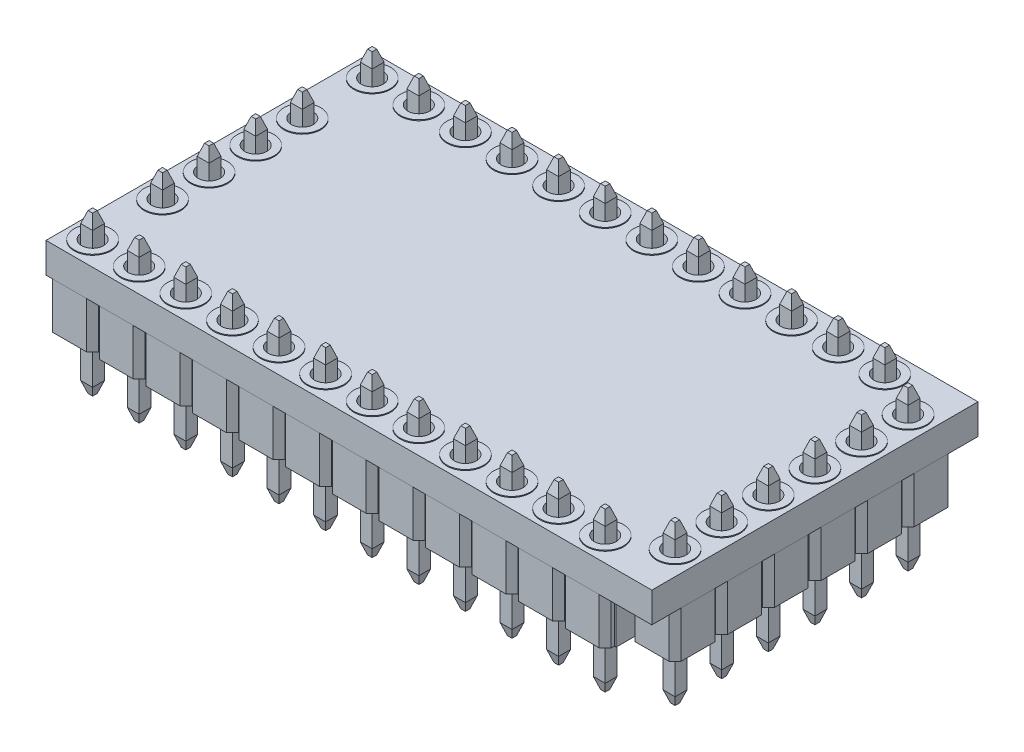
from build123d import *
from OCP.BRepFilletAPI import BRepFilletAPI_MakeChamfer

# Parameters (mm, degrees)
SKETCH1_W                   = 33.02
SKETCH1_H                   = 17.78
BOSS_EXTRUDE1_DEPTH         = 1.64
SKETCH2_R                   = 0.6
CUT_EXTRUDE1_DEPTH          = 19.822906258
SKETCH3_R                   = 1
SKETCH3_R_2                 = 0.6
BOSS_EXTRUDE2_DEPTH         = 0.05
BOSS_EXTRUDE4_DEPTH         = 2.54
BOSS_EXTRUDE5_START         = -3.05
SKETCH6_W                   = 0.65
SKETCH6_H                   = 0.65
BOSS_EXTRUDE5_DEPTH         = 8.64
CHAMFER1_SIZE               = 0.2
CHAMFER1_SIZE2              = 0.615536707
LPATTERN2_COUNT             = 12
LPATTERN2_PITCH             = 2.54
CHAMFER1_OF_LPATTERN2_SIZE  = 0.2
CHAMFER1_OF_LPATTERN2_SIZE2 = 0.615536707
BOSS_EXTRUDE6_DEPTH         = 2.54
BOSS_EXTRUDE7_START         = -5.07
SKETCH8_W                   = 0.65
SKETCH8_H                   = 0.65
BOSS_EXTRUDE7_DEPTH         = 8.12
CHAMFER2_SIZE               = 0.2
CHAMFER2_SIZE2              = 0.615536707
LPATTERN7_COUNT             = 4
LPATTERN7_PITCH             = 2.54
CHAMFER2_OF_LPATTERN7_SIZE  = 0.2
CHAMFER2_OF_LPATTERN7_SIZE2 = 0.615536707
BOSS_EXTRUDE8_DEPTH         = 2.54
BOSS_EXTRUDE9_START         = -5.59
SKETCH10_W                  = 0.65
SKETCH10_H                  = 0.65
BOSS_EXTRUDE9_DEPTH         = 8.64
CHAMFER3_SIZE               = 0.2
CHAMFER3_SIZE2              = 0.615536707
LPATTERN8_COUNT             = 6
LPATTERN8_PITCH             = 2.54
CHAMFER3_OF_LPATTERN8_SIZE  = 0.2
CHAMFER3_OF_LPATTERN8_SIZE2 = 0.615536707


with BuildPart() as part:
    # Sketch1 → Boss-Extrude1 (new body)
    with BuildSketch(Plane(origin=(0, 2.54, 0), x_dir=(1, 0, 0), z_dir=(0, 1, 0))):
        Rectangle(SKETCH1_W, SKETCH1_H)
    extrude(amount=BOSS_EXTRUDE1_DEPTH)

    # Sketch2 → Cut-Extrude1 (cut, through all)
    with BuildSketch(Plane.XZ.offset(-2.54)):
        with Locations(Location((-15.24, 7.62, 0), (0, 0, 270))):
            Circle(SKETCH2_R)
        with Locations(Location((-12.7, 7.62, 0), (0, 0, 270))):
            Circle(SKETCH2_R)
        with Locations(Location((-10.16, 7.62, 0), (0, 0, 270))):
            Circle(SKETCH2_R)
        with Locations(Location((-7.62, 7.62, 0), (0, 0, 270))):
            Circle(SKETCH2_R)
        with Locations(Location((-5.08, 7.62, 0), (0, 0, 270))):
            Circle(SKETCH2_R)
        with Locations(Location((-2.54, 7.62, 0), (0, 0, 270))):
            Circle(SKETCH2_R)
        with Locations(Location((0, 7.62, 0), (0, 0, 270))):
            Circle(SKETCH2_R)
        with Locations(Location((2.54, 7.62, 0), (0, 0, 270))):
            Circle(SKETCH2_R)
        with Locations(Location((5.08, 7.62, 0), (0, 0, 270))):
            Circle(SKETCH2_R)
        with Locations(Location((7.62, 7.62, 0), (0, 0, 270))):
            Circle(SKETCH2_R)
        with Locations(Location((10.16, 7.62, 0), (0, 0, 270))):
            Circle(SKETCH2_R)
        with Locations(Location((12.7, 7.62, 0), (0, 0, 270))):
            Circle(SKETCH2_R)
        with Locations(Location((12.7, -7.62, 0), (0, 0, 90))):
            Circle(SKETCH2_R)
        with Locations(Location((10.16, -7.62, 0), (0, 0, 90))):
            Circle(SKETCH2_R)
        with Locations(Location((7.62, -7.62, 0), (0, 0, 90))):
            Circle(SKETCH2_R)
        with Locations(Location((5.08, -7.62, 0), (0, 0, 90))):
            Circle(SKETCH2_R)
        with Locations(Location((2.54, -7.62, 0), (0, 0, 90))):
            Circle(SKETCH2_R)
        with Locations(Location((0, -7.62, 0), (0, 0, 90))):
            Circle(SKETCH2_R)
        with Locations(Location((-2.54, -7.62, 0), (0, 0, 90))):
            Circle(SKETCH2_R)
        with Locations(Location((-5.08, -7.62, 0), (0, 0, 90))):
            Circle(SKETCH2_R)
        with Locations(Location((-7.62, -7.62, 0), (0, 0, 90))):
            Circle(SKETCH2_R)
        with Locations(Location((-10.16, -7.62, 0), (0, 0, 90))):
            Circle(SKETCH2_R)
        with Locations(Location((-12.7, -7.62, 0), (0, 0, 90))):
            Circle(SKETCH2_R)
        with Locations(Location((-15.24, -7.62, 0), (0, 0, 90))):
            Circle(SKETCH2_R)
        with Locations(Location((-15.24, 3.81, 0), (0, 0, 270))):
            Circle(SKETCH2_R)
        with Locations(Location((15.24, 6.35, 0), (0, 0, 270))):
            Circle(SKETCH2_R)
        with Locations(Location((-15.24, 1.27, 0), (0, 0, 270))):
            Circle(SKETCH2_R)
        with Locations(Location((-15.24, -1.27, 0), (0, 0, 270))):
            Circle(SKETCH2_R)
        with Locations(Location((-15.24, -3.81, 0), (0, 0, 270))):
            Circle(SKETCH2_R)
        with Locations(Location((15.24, 3.81, 0), (0, 0, 270))):
            Circle(SKETCH2_R)
        with Locations(Location((15.24, 1.27, 0), (0, 0, 270))):
            Circle(SKETCH2_R)
        with Locations(Location((15.24, -1.27, 0), (0, 0, 270))):
            Circle(SKETCH2_R)
        with Locations(Location((15.24, -3.81, 0), (0, 0, 270))):
            Circle(SKETCH2_R)
        with Locations(Location((15.24, -6.35, 0), (0, 0, 270))):
            Circle(SKETCH2_R)
    extrude(amount=-CUT_EXTRUDE1_DEPTH, mode=Mode.SUBTRACT)

    # Sketch3 → Boss-Extrude2 (add)
    # profile 1 of 34: a face of its own
    with BuildSketch(Plane(origin=(0, 4.18, 0), x_dir=(1, 0, 0), z_dir=(0, 1, 0))):
        with Locations(Location((-15.24, 7.62, 0), (0, 0, 270))):
            Circle(SKETCH3_R)
        with Locations(Location((-15.24, 7.62, 0), (0, 0, 270))):
            Circle(SKETCH3_R_2, mode=Mode.SUBTRACT)
    # profile 2 of 34: a face of its own
    with BuildSketch(Plane(origin=(0, 4.18, 0), x_dir=(1, 0, 0), z_dir=(0, 1, 0))):
        with Locations(Location((-12.7, 7.62, 0), (0, 0, 270))):
            Circle(SKETCH3_R)
        with Locations(Location((-12.7, 7.62, 0), (0, 0, 270))):
            Circle(SKETCH3_R_2, mode=Mode.SUBTRACT)
    # profile 3 of 34: a face of its own
    with BuildSketch(Plane(origin=(0, 4.18, 0), x_dir=(1, 0, 0), z_dir=(0, 1, 0))):
        with Locations(Location((-10.16, 7.62, 0), (0, 0, 270))):
            Circle(SKETCH3_R)
        with Locations(Location((-10.16, 7.62, 0), (0, 0, 270))):
            Circle(SKETCH3_R_2, mode=Mode.SUBTRACT)
    # profile 4 of 34: a face of its own
    with BuildSketch(Plane(origin=(0, 4.18, 0), x_dir=(1, 0, 0), z_dir=(0, 1, 0))):
        with Locations(Location((-7.62, 7.62, 0), (0, 0, 270))):
            Circle(SKETCH3_R)
        with Locations(Location((-7.62, 7.62, 0), (0, 0, 270))):
            Circle(SKETCH3_R_2, mode=Mode.SUBTRACT)
    # profile 5 of 34: a face of its own
    with BuildSketch(Plane(origin=(0, 4.18, 0), x_dir=(1, 0, 0), z_dir=(0, 1, 0))):
        with Locations(Location((-5.08, 7.62, 0), (0, 0, 270))):
            Circle(SKETCH3_R)
        with Locations(Location((-5.08, 7.62, 0), (0, 0, 270))):
            Circle(SKETCH3_R_2, mode=Mode.SUBTRACT)
    # profile 6 of 34: a face of its own
    with BuildSketch(Plane(origin=(0, 4.18, 0), x_dir=(1, 0, 0), z_dir=(0, 1, 0))):
        with Locations(Location((-2.54, 7.62, 0), (0, 0, 270))):
            Circle(SKETCH3_R)
        with Locations(Location((-2.54, 7.62, 0), (0, 0, 270))):
            Circle(SKETCH3_R_2, mode=Mode.SUBTRACT)
    # profile 7 of 34: a face of its own
    with BuildSketch(Plane(origin=(0, 4.18, 0), x_dir=(1, 0, 0), z_dir=(0, 1, 0))):
        with Locations(Location((0, 7.62, 0), (0, 0, 270))):
            Circle(SKETCH3_R)
        with Locations(Location((0, 7.62, 0), (0, 0, 270))):
            Circle(SKETCH3_R_2, mode=Mode.SUBTRACT)
    # profile 8 of 34: a face of its own
    with BuildSketch(Plane(origin=(0, 4.18, 0), x_dir=(1, 0, 0), z_dir=(0, 1, 0))):
        with Locations(Location((2.54, 7.62, 0), (0, 0, 270))):
            Circle(SKETCH3_R)
        with Locations(Location((2.54, 7.62, 0), (0, 0, 270))):
            Circle(SKETCH3_R_2, mode=Mode.SUBTRACT)
    # profile 9 of 34: a face of its own
    with BuildSketch(Plane(origin=(0, 4.18, 0), x_dir=(1, 0, 0), z_dir=(0, 1, 0))):
        with Locations(Location((5.08, 7.62, 0), (0, 0, 270))):
            Circle(SKETCH3_R)
        with Locations(Location((5.08, 7.62, 0), (0, 0, 270))):
            Circle(SKETCH3_R_2, mode=Mode.SUBTRACT)
    # profile 10 of 34: a face of its own
    with BuildSketch(Plane(origin=(0, 4.18, 0), x_dir=(1, 0, 0), z_dir=(0, 1, 0))):
        with Locations(Location((7.62, 7.62, 0), (0, 0, 270))):
            Circle(SKETCH3_R)
        with Locations(Location((7.62, 7.62, 0), (0, 0, 270))):
            Circle(SKETCH3_R_2, mode=Mode.SUBTRACT)
    # profile 11 of 34: a face of its own
    with BuildSketch(Plane(origin=(0, 4.18, 0), x_dir=(1, 0, 0), z_dir=(0, 1, 0))):
        with Locations(Location((10.16, 7.62, 0), (0, 0, 270))):
            Circle(SKETCH3_R)
        with Locations(Location((10.16, 7.62, 0), (0, 0, 270))):
            Circle(SKETCH3_R_2, mode=Mode.SUBTRACT)
    # profile 12 of 34: a face of its own
    with BuildSketch(Plane(origin=(0, 4.18, 0), x_dir=(1, 0, 0), z_dir=(0, 1, 0))):
        with Locations(Location((12.7, 7.62, 0), (0, 0, 270))):
            Circle(SKETCH3_R)
        with Locations(Location((12.7, 7.62, 0), (0, 0, 270))):
            Circle(SKETCH3_R_2, mode=Mode.SUBTRACT)
    # profile 13 of 34: a face of its own
    with BuildSketch(Plane(origin=(0, 4.18, 0), x_dir=(1, 0, 0), z_dir=(0, 1, 0))):
        with Locations(Location((15.24, 6.35, 0), (0, 0, 270))):
            Circle(SKETCH3_R)
        with Locations(Location((15.24, 6.35, 0), (0, 0, 90))):
            Circle(SKETCH3_R_2, mode=Mode.SUBTRACT)
    # profile 14 of 34: a face of its own
    with BuildSketch(Plane(origin=(0, 4.18, 0), x_dir=(1, 0, 0), z_dir=(0, 1, 0))):
        with Locations(Location((15.24, 3.81, 0), (0, 0, 270))):
            Circle(SKETCH3_R)
        with Locations(Location((15.24, 3.81, 0), (0, 0, 90))):
            Circle(SKETCH3_R_2, mode=Mode.SUBTRACT)
    # profile 15 of 34: a face of its own
    with BuildSketch(Plane(origin=(0, 4.18, 0), x_dir=(1, 0, 0), z_dir=(0, 1, 0))):
        with Locations(Location((15.24, 1.27, 0), (0, 0, 270))):
            Circle(SKETCH3_R)
        with Locations(Location((15.24, 1.27, 0), (0, 0, 90))):
            Circle(SKETCH3_R_2, mode=Mode.SUBTRACT)
    # profile 16 of 34: a face of its own
    with BuildSketch(Plane(origin=(0, 4.18, 0), x_dir=(1, 0, 0), z_dir=(0, 1, 0))):
        with Locations(Location((15.24, -1.27, 0), (0, 0, 270))):
            Circle(SKETCH3_R)
        with Locations(Location((15.24, -1.27, 0), (0, 0, 90))):
            Circle(SKETCH3_R_2, mode=Mode.SUBTRACT)
    # profile 17 of 34: a face of its own
    with BuildSketch(Plane(origin=(0, 4.18, 0), x_dir=(1, 0, 0), z_dir=(0, 1, 0))):
        with Locations(Location((15.24, -3.81, 0), (0, 0, 270))):
            Circle(SKETCH3_R)
        with Locations(Location((15.24, -3.81, 0), (0, 0, 90))):
            Circle(SKETCH3_R_2, mode=Mode.SUBTRACT)
    # profile 18 of 34: a face of its own
    with BuildSketch(Plane(origin=(0, 4.18, 0), x_dir=(1, 0, 0), z_dir=(0, 1, 0))):
        with Locations(Location((15.24, -6.35, 0), (0, 0, 270))):
            Circle(SKETCH3_R)
        with Locations(Location((15.24, -6.35, 0), (0, 0, 90))):
            Circle(SKETCH3_R_2, mode=Mode.SUBTRACT)
    # profile 19 of 34: a face of its own
    with BuildSketch(Plane(origin=(0, 4.18, 0), x_dir=(1, 0, 0), z_dir=(0, 1, 0))):
        with Locations(Location((12.7, -7.62, 0), (0, 0, 270))):
            Circle(SKETCH3_R)
        with Locations(Location((12.7, -7.62, 0), (0, 0, 90))):
            Circle(SKETCH3_R_2, mode=Mode.SUBTRACT)
    # profile 20 of 34: a face of its own
    with BuildSketch(Plane(origin=(0, 4.18, 0), x_dir=(1, 0, 0), z_dir=(0, 1, 0))):
        with Locations(Location((10.16, -7.62, 0), (0, 0, 270))):
            Circle(SKETCH3_R)
        with Locations(Location((10.16, -7.62, 0), (0, 0, 90))):
            Circle(SKETCH3_R_2, mode=Mode.SUBTRACT)
    # profile 21 of 34: a face of its own
    with BuildSketch(Plane(origin=(0, 4.18, 0), x_dir=(1, 0, 0), z_dir=(0, 1, 0))):
        with Locations(Location((7.62, -7.62, 0), (0, 0, 270))):
            Circle(SKETCH3_R)
        with Locations(Location((7.62, -7.62, 0), (0, 0, 90))):
            Circle(SKETCH3_R_2, mode=Mode.SUBTRACT)
    # profile 22 of 34: a face of its own
    with BuildSketch(Plane(origin=(0, 4.18, 0), x_dir=(1, 0, 0), z_dir=(0, 1, 0))):
        with Locations(Location((5.08, -7.62, 0), (0, 0, 270))):
            Circle(SKETCH3_R)
        with Locations(Location((5.08, -7.62, 0), (0, 0, 90))):
            Circle(SKETCH3_R_2, mode=Mode.SUBTRACT)
    # profile 23 of 34: a face of its own
    with BuildSketch(Plane(origin=(0, 4.18, 0), x_dir=(1, 0, 0), z_dir=(0, 1, 0))):
        with Locations(Location((2.54, -7.62, 0), (0, 0, 270))):
            Circle(SKETCH3_R)
        with Locations(Location((2.54, -7.62, 0), (0, 0, 90))):
            Circle(SKETCH3_R_2, mode=Mode.SUBTRACT)
    # profile 24 of 34: a face of its own
    with BuildSketch(Plane(origin=(0, 4.18, 0), x_dir=(1, 0, 0), z_dir=(0, 1, 0))):
        with Locations(Location((0, -7.62, 0), (0, 0, 270))):
            Circle(SKETCH3_R)
        with Locations(Location((0, -7.62, 0), (0, 0, 90))):
            Circle(SKETCH3_R_2, mode=Mode.SUBTRACT)
    # profile 25 of 34: a face of its own
    with BuildSketch(Plane(origin=(0, 4.18, 0), x_dir=(1, 0, 0), z_dir=(0, 1, 0))):
        with Locations(Location((-2.54, -7.62, 0), (0, 0, 270))):
            Circle(SKETCH3_R)
        with Locations(Location((-2.54, -7.62, 0), (0, 0, 90))):
            Circle(SKETCH3_R_2, mode=Mode.SUBTRACT)
    # profile 26 of 34: a face of its own
    with BuildSketch(Plane(origin=(0, 4.18, 0), x_dir=(1, 0, 0), z_dir=(0, 1, 0))):
        with Locations(Location((-5.08, -7.62, 0), (0, 0, 270))):
            Circle(SKETCH3_R)
        with Locations(Location((-5.08, -7.62, 0), (0, 0, 90))):
            Circle(SKETCH3_R_2, mode=Mode.SUBTRACT)
    # profile 27 of 34: a face of its own
    with BuildSketch(Plane(origin=(0, 4.18, 0), x_dir=(1, 0, 0), z_dir=(0, 1, 0))):
        with Locations(Location((-7.62, -7.62, 0), (0, 0, 270))):
            Circle(SKETCH3_R)
        with Locations(Location((-7.62, -7.62, 0), (0, 0, 90))):
            Circle(SKETCH3_R_2, mode=Mode.SUBTRACT)
    # profile 28 of 34: a face of its own
    with BuildSketch(Plane(origin=(0, 4.18, 0), x_dir=(1, 0, 0), z_dir=(0, 1, 0))):
        with Locations(Location((-10.16, -7.62, 0), (0, 0, 270))):
            Circle(SKETCH3_R)
        with Locations(Location((-10.16, -7.62, 0), (0, 0, 90))):
            Circle(SKETCH3_R_2, mode=Mode.SUBTRACT)
    # profile 29 of 34: a face of its own
    with BuildSketch(Plane(origin=(0, 4.18, 0), x_dir=(1, 0, 0), z_dir=(0, 1, 0))):
        with Locations(Location((-12.7, -7.62, 0), (0, 0, 270))):
            Circle(SKETCH3_R)
        with Locations(Location((-12.7, -7.62, 0), (0, 0, 90))):
            Circle(SKETCH3_R_2, mode=Mode.SUBTRACT)
    # profile 30 of 34: a face of its own
    with BuildSketch(Plane(origin=(0, 4.18, 0), x_dir=(1, 0, 0), z_dir=(0, 1, 0))):
        with Locations(Location((-15.24, -7.62, 0), (0, 0, 270))):
            Circle(SKETCH3_R)
        with Locations(Location((-15.24, -7.62, 0), (0, 0, 90))):
            Circle(SKETCH3_R_2, mode=Mode.SUBTRACT)
    # profile 31 of 34: a face of its own
    with BuildSketch(Plane(origin=(0, 4.18, 0), x_dir=(1, 0, 0), z_dir=(0, 1, 0))):
        with Locations(Location((-15.24, -3.81, 0), (0, 0, 270))):
            Circle(SKETCH3_R)
        with Locations(Location((-15.24, -3.81, 0), (0, 0, 90))):
            Circle(SKETCH3_R_2, mode=Mode.SUBTRACT)
    # profile 32 of 34: a face of its own
    with BuildSketch(Plane(origin=(0, 4.18, 0), x_dir=(1, 0, 0), z_dir=(0, 1, 0))):
        with Locations(Location((-15.24, -1.27, 0), (0, 0, 270))):
            Circle(SKETCH3_R)
        with Locations(Location((-15.24, -1.27, 0), (0, 0, 90))):
            Circle(SKETCH3_R_2, mode=Mode.SUBTRACT)
    # profile 33 of 34: a face of its own
    with BuildSketch(Plane(origin=(0, 4.18, 0), x_dir=(1, 0, 0), z_dir=(0, 1, 0))):
        with Locations(Location((-15.24, 1.27, 0), (0, 0, 270))):
            Circle(SKETCH3_R)
        with Locations(Location((-15.24, 1.27, 0), (0, 0, 90))):
            Circle(SKETCH3_R_2, mode=Mode.SUBTRACT)
    # profile 34 of 34: a face of its own
    with BuildSketch(Plane(origin=(0, 4.18, 0), x_dir=(1, 0, 0), z_dir=(0, 1, 0))):
        with Locations(Location((-15.24, 3.81, 0), (0, 0, 270))):
            Circle(SKETCH3_R)
        with Locations(Location((-15.24, 3.81, 0), (0, 0, 90))):
            Circle(SKETCH3_R_2, mode=Mode.SUBTRACT)
    extrude(amount=BOSS_EXTRUDE2_DEPTH)

    # Sketch5 → Boss-Extrude4 (add)
    with BuildSketch(Plane.XZ):
        Polygon((-16.165, 8.87), (-16.49, 8.545), (-16.49, 6.695), (-16.165, 6.37), (-14.315, 6.37), (-13.99, 6.695), (-13.99, 6.87), (-13.89, 6.87), (-13.89, 8.37), (-13.99, 8.37), (-13.99, 8.545), (-14.315, 8.87), align=None)
    boss_extrude4 = extrude(amount=-BOSS_EXTRUDE4_DEPTH)

    # Sketch6 → Boss-Extrude5 (add)
    with BuildSketch(Plane(origin=(0, 2.54, 0), x_dir=(-1, 0, 0), z_dir=(0, -1, 0)).offset(BOSS_EXTRUDE5_START)):
        with Locations((15.24, -7.62)):
            Rectangle(SKETCH6_W, SKETCH6_H)
    boss_extrude5 = extrude(amount=BOSS_EXTRUDE5_DEPTH)

    # Chamfer1: one chamfer whose edges measure the first distance from different faces: ONE call of the kernel's chamfer builder (chamfer() names one face for all edges)
    chamfer1_edges_1 = [part.edges().sort_by_distance(p)[0] for p in [
        (-15.565, 5.59, 7.62),
        (-15.24, 5.59, 7.945),
        (-14.915, 5.59, 7.62),
        (-15.24, 5.59, 7.295),
    ]]
    chamfer1_side_1 = [part.faces().sort_by_distance(p)[0] for p in [
        (-15.24, 5.59, 7.62),
    ]]
    chamfer1_edges_2 = [part.edges().sort_by_distance(p)[0] for p in [
        (-15.565, -3.05, 7.62),
        (-15.24, -3.05, 7.295),
        (-14.915, -3.05, 7.62),
        (-15.24, -3.05, 7.945),
    ]]
    chamfer1_side_2 = [part.faces().sort_by_distance(p)[0] for p in [
        (-15.24, -3.05, 7.62),
    ]]
    chamfer1 = BRepFilletAPI_MakeChamfer(part.part.solid().wrapped)
    for e in chamfer1_edges_1:
        chamfer1.Add(CHAMFER1_SIZE, CHAMFER1_SIZE2, e.wrapped, chamfer1_side_1[0].wrapped)  # the first distance lies on this face
    for e in chamfer1_edges_2:
        chamfer1.Add(CHAMFER1_SIZE, CHAMFER1_SIZE2, e.wrapped, chamfer1_side_2[0].wrapped)  # the first distance lies on this face
    add(Compound.cast(chamfer1.Shape()), mode=Mode.REPLACE)

    # LPattern2: Boss-Extrude4, Boss-Extrude5 ×12
    with Locations(*[(i * LPATTERN2_PITCH, 0, 0) for i in range(1, LPATTERN2_COUNT)]):
        add(boss_extrude4)
        add(boss_extrude5)

    # Chamfer1 of LPattern2: one chamfer whose edges measure the first distance from different faces: ONE call of the kernel's chamfer builder (chamfer() names one face for all edges)
    chamfer1_of_lpattern2_edges_1 = [part.edges().sort_by_distance(p)[0] for p in [
        (-13.025, 5.59, 7.62),
        (-12.7, 5.59, 7.945),
        (-12.375, 5.59, 7.62),
        (-12.7, 5.59, 7.295),
    ]]
    chamfer1_of_lpattern2_side_1 = [part.faces().sort_by_distance(p)[0] for p in [
        (-12.7, 5.59, 7.62),
    ]]
    chamfer1_of_lpattern2_edges_2 = [part.edges().sort_by_distance(p)[0] for p in [
        (-13.025, -3.05, 7.62),
        (-12.7, -3.05, 7.295),
        (-12.375, -3.05, 7.62),
        (-12.7, -3.05, 7.945),
    ]]
    chamfer1_of_lpattern2_side_2 = [part.faces().sort_by_distance(p)[0] for p in [
        (-12.7, -3.05, 7.62),
    ]]
    chamfer1_of_lpattern2_edges_3 = [part.edges().sort_by_distance(p)[0] for p in [
        (-10.485, 5.59, 7.62),
        (-10.16, 5.59, 7.945),
        (-9.835, 5.59, 7.62),
        (-10.16, 5.59, 7.295),
    ]]
    chamfer1_of_lpattern2_side_3 = [part.faces().sort_by_distance(p)[0] for p in [
        (-10.16, 5.59, 7.62),
    ]]
    chamfer1_of_lpattern2_edges_4 = [part.edges().sort_by_distance(p)[0] for p in [
        (-10.485, -3.05, 7.62),
        (-10.16, -3.05, 7.295),
        (-9.835, -3.05, 7.62),
        (-10.16, -3.05, 7.945),
    ]]
    chamfer1_of_lpattern2_side_4 = [part.faces().sort_by_distance(p)[0] for p in [
        (-10.16, -3.05, 7.62),
    ]]
    chamfer1_of_lpattern2_edges_5 = [part.edges().sort_by_distance(p)[0] for p in [
        (-7.945, 5.59, 7.62),
        (-7.62, 5.59, 7.945),
        (-7.295, 5.59, 7.62),
        (-7.62, 5.59, 7.295),
    ]]
    chamfer1_of_lpattern2_side_5 = [part.faces().sort_by_distance(p)[0] for p in [
        (-7.62, 5.59, 7.62),
    ]]
    chamfer1_of_lpattern2_edges_6 = [part.edges().sort_by_distance(p)[0] for p in [
        (-7.945, -3.05, 7.62),
        (-7.62, -3.05, 7.295),
        (-7.295, -3.05, 7.62),
        (-7.62, -3.05, 7.945),
    ]]
    chamfer1_of_lpattern2_side_6 = [part.faces().sort_by_distance(p)[0] for p in [
        (-7.62, -3.05, 7.62),
    ]]
    chamfer1_of_lpattern2_edges_7 = [part.edges().sort_by_distance(p)[0] for p in [
        (-5.405, 5.59, 7.62),
        (-5.08, 5.59, 7.945),
        (-4.755, 5.59, 7.62),
        (-5.08, 5.59, 7.295),
    ]]
    chamfer1_of_lpattern2_side_7 = [part.faces().sort_by_distance(p)[0] for p in [
        (-5.08, 5.59, 7.62),
    ]]
    chamfer1_of_lpattern2_edges_8 = [part.edges().sort_by_distance(p)[0] for p in [
        (-5.405, -3.05, 7.62),
        (-5.08, -3.05, 7.295),
        (-4.755, -3.05, 7.62),
        (-5.08, -3.05, 7.945),
    ]]
    chamfer1_of_lpattern2_side_8 = [part.faces().sort_by_distance(p)[0] for p in [
        (-5.08, -3.05, 7.62),
    ]]
    chamfer1_of_lpattern2_edges_9 = [part.edges().sort_by_distance(p)[0] for p in [
        (-2.865, 5.59, 7.62),
        (-2.54, 5.59, 7.945),
        (-2.215, 5.59, 7.62),
        (-2.54, 5.59, 7.295),
    ]]
    chamfer1_of_lpattern2_side_9 = [part.faces().sort_by_distance(p)[0] for p in [
        (-2.54, 5.59, 7.62),
    ]]
    chamfer1_of_lpattern2_edges_10 = [part.edges().sort_by_distance(p)[0] for p in [
        (-2.865, -3.05, 7.62),
        (-2.54, -3.05, 7.295),
        (-2.215, -3.05, 7.62),
        (-2.54, -3.05, 7.945),
    ]]
    chamfer1_of_lpattern2_side_10 = [part.faces().sort_by_distance(p)[0] for p in [
        (-2.54, -3.05, 7.62),
    ]]
    chamfer1_of_lpattern2_edges_11 = [part.edges().sort_by_distance(p)[0] for p in [
        (-0.325, 5.59, 7.62),
        (0, 5.59, 7.945),
        (0.325, 5.59, 7.62),
        (0, 5.59, 7.295),
    ]]
    chamfer1_of_lpattern2_side_11 = [part.faces().sort_by_distance(p)[0] for p in [
        (0, 5.59, 7.62),
    ]]
    chamfer1_of_lpattern2_edges_12 = [part.edges().sort_by_distance(p)[0] for p in [
        (-0.325, -3.05, 7.62),
        (0, -3.05, 7.295),
        (0.325, -3.05, 7.62),
        (0, -3.05, 7.945),
    ]]
    chamfer1_of_lpattern2_side_12 = [part.faces().sort_by_distance(p)[0] for p in [
        (0, -3.05, 7.62),
    ]]
    chamfer1_of_lpattern2_edges_13 = [part.edges().sort_by_distance(p)[0] for p in [
        (2.215, 5.59, 7.62),
        (2.54, 5.59, 7.945),
        (2.865, 5.59, 7.62),
        (2.54, 5.59, 7.295),
    ]]
    chamfer1_of_lpattern2_side_13 = [part.faces().sort_by_distance(p)[0] for p in [
        (2.54, 5.59, 7.62),
    ]]
    chamfer1_of_lpattern2_edges_14 = [part.edges().sort_by_distance(p)[0] for p in [
        (2.215, -3.05, 7.62),
        (2.54, -3.05, 7.295),
        (2.865, -3.05, 7.62),
        (2.54, -3.05, 7.945),
    ]]
    chamfer1_of_lpattern2_side_14 = [part.faces().sort_by_distance(p)[0] for p in [
        (2.54, -3.05, 7.62),
    ]]
    chamfer1_of_lpattern2_edges_15 = [part.edges().sort_by_distance(p)[0] for p in [
        (4.755, 5.59, 7.62),
        (5.08, 5.59, 7.945),
        (5.405, 5.59, 7.62),
        (5.08, 5.59, 7.295),
    ]]
    chamfer1_of_lpattern2_side_15 = [part.faces().sort_by_distance(p)[0] for p in [
        (5.08, 5.59, 7.62),
    ]]
    chamfer1_of_lpattern2_edges_16 = [part.edges().sort_by_distance(p)[0] for p in [
        (4.755, -3.05, 7.62),
        (5.08, -3.05, 7.295),
        (5.405, -3.05, 7.62),
        (5.08, -3.05, 7.945),
    ]]
    chamfer1_of_lpattern2_side_16 = [part.faces().sort_by_distance(p)[0] for p in [
        (5.08, -3.05, 7.62),
    ]]
    chamfer1_of_lpattern2_edges_17 = [part.edges().sort_by_distance(p)[0] for p in [
        (7.295, 5.59, 7.62),
        (7.62, 5.59, 7.945),
        (7.945, 5.59, 7.62),
        (7.62, 5.59, 7.295),
    ]]
    chamfer1_of_lpattern2_side_17 = [part.faces().sort_by_distance(p)[0] for p in [
        (7.62, 5.59, 7.62),
    ]]
    chamfer1_of_lpattern2_edges_18 = [part.edges().sort_by_distance(p)[0] for p in [
        (7.295, -3.05, 7.62),
        (7.62, -3.05, 7.295),
        (7.945, -3.05, 7.62),
        (7.62, -3.05, 7.945),
    ]]
    chamfer1_of_lpattern2_side_18 = [part.faces().sort_by_distance(p)[0] for p in [
        (7.62, -3.05, 7.62),
    ]]
    chamfer1_of_lpattern2_edges_19 = [part.edges().sort_by_distance(p)[0] for p in [
        (9.835, 5.59, 7.62),
        (10.16, 5.59, 7.945),
        (10.485, 5.59, 7.62),
        (10.16, 5.59, 7.295),
    ]]
    chamfer1_of_lpattern2_side_19 = [part.faces().sort_by_distance(p)[0] for p in [
        (10.16, 5.59, 7.62),
    ]]
    chamfer1_of_lpattern2_edges_20 = [part.edges().sort_by_distance(p)[0] for p in [
        (9.835, -3.05, 7.62),
        (10.16, -3.05, 7.295),
        (10.485, -3.05, 7.62),
        (10.16, -3.05, 7.945),
    ]]
    chamfer1_of_lpattern2_side_20 = [part.faces().sort_by_distance(p)[0] for p in [
        (10.16, -3.05, 7.62),
    ]]
    chamfer1_of_lpattern2_edges_21 = [part.edges().sort_by_distance(p)[0] for p in [
        (12.375, 5.59, 7.62),
        (12.7, 5.59, 7.945),
        (13.025, 5.59, 7.62),
        (12.7, 5.59, 7.295),
    ]]
    chamfer1_of_lpattern2_side_21 = [part.faces().sort_by_distance(p)[0] for p in [
        (12.7, 5.59, 7.62),
    ]]
    chamfer1_of_lpattern2_edges_22 = [part.edges().sort_by_distance(p)[0] for p in [
        (12.375, -3.05, 7.62),
        (12.7, -3.05, 7.295),
        (13.025, -3.05, 7.62),
        (12.7, -3.05, 7.945),
    ]]
    chamfer1_of_lpattern2_side_22 = [part.faces().sort_by_distance(p)[0] for p in [
        (12.7, -3.05, 7.62),
    ]]
    chamfer1_of_lpattern2 = BRepFilletAPI_MakeChamfer(part.part.solid().wrapped)
    for e in chamfer1_of_lpattern2_edges_1:
        chamfer1_of_lpattern2.Add(CHAMFER1_OF_LPATTERN2_SIZE, CHAMFER1_OF_LPATTERN2_SIZE2, e.wrapped, chamfer1_of_lpattern2_side_1[0].wrapped)  # the first distance lies on this face
    for e in chamfer1_of_lpattern2_edges_2:
        chamfer1_of_lpattern2.Add(CHAMFER1_OF_LPATTERN2_SIZE, CHAMFER1_OF_LPATTERN2_SIZE2, e.wrapped, chamfer1_of_lpattern2_side_2[0].wrapped)  # the first distance lies on this face
    for e in chamfer1_of_lpattern2_edges_3:
        chamfer1_of_lpattern2.Add(CHAMFER1_OF_LPATTERN2_SIZE, CHAMFER1_OF_LPATTERN2_SIZE2, e.wrapped, chamfer1_of_lpattern2_side_3[0].wrapped)  # the first distance lies on this face
    for e in chamfer1_of_lpattern2_edges_4:
        chamfer1_of_lpattern2.Add(CHAMFER1_OF_LPATTERN2_SIZE, CHAMFER1_OF_LPATTERN2_SIZE2, e.wrapped, chamfer1_of_lpattern2_side_4[0].wrapped)  # the first distance lies on this face
    for e in chamfer1_of_lpattern2_edges_5:
        chamfer1_of_lpattern2.Add(CHAMFER1_OF_LPATTERN2_SIZE, CHAMFER1_OF_LPATTERN2_SIZE2, e.wrapped, chamfer1_of_lpattern2_side_5[0].wrapped)  # the first distance lies on this face
    for e in chamfer1_of_lpattern2_edges_6:
        chamfer1_of_lpattern2.Add(CHAMFER1_OF_LPATTERN2_SIZE, CHAMFER1_OF_LPATTERN2_SIZE2, e.wrapped, chamfer1_of_lpattern2_side_6[0].wrapped)  # the first distance lies on this face
    for e in chamfer1_of_lpattern2_edges_7:
        chamfer1_of_lpattern2.Add(CHAMFER1_OF_LPATTERN2_SIZE, CHAMFER1_OF_LPATTERN2_SIZE2, e.wrapped, chamfer1_of_lpattern2_side_7[0].wrapped)  # the first distance lies on this face
    for e in chamfer1_of_lpattern2_edges_8:
        chamfer1_of_lpattern2.Add(CHAMFER1_OF_LPATTERN2_SIZE, CHAMFER1_OF_LPATTERN2_SIZE2, e.wrapped, chamfer1_of_lpattern2_side_8[0].wrapped)  # the first distance lies on this face
    for e in chamfer1_of_lpattern2_edges_9:
        chamfer1_of_lpattern2.Add(CHAMFER1_OF_LPATTERN2_SIZE, CHAMFER1_OF_LPATTERN2_SIZE2, e.wrapped, chamfer1_of_lpattern2_side_9[0].wrapped)  # the first distance lies on this face
    for e in chamfer1_of_lpattern2_edges_10:
        chamfer1_of_lpattern2.Add(CHAMFER1_OF_LPATTERN2_SIZE, CHAMFER1_OF_LPATTERN2_SIZE2, e.wrapped, chamfer1_of_lpattern2_side_10[0].wrapped)  # the first distance lies on this face
    for e in chamfer1_of_lpattern2_edges_11:
        chamfer1_of_lpattern2.Add(CHAMFER1_OF_LPATTERN2_SIZE, CHAMFER1_OF_LPATTERN2_SIZE2, e.wrapped, chamfer1_of_lpattern2_side_11[0].wrapped)  # the first distance lies on this face
    for e in chamfer1_of_lpattern2_edges_12:
        chamfer1_of_lpattern2.Add(CHAMFER1_OF_LPATTERN2_SIZE, CHAMFER1_OF_LPATTERN2_SIZE2, e.wrapped, chamfer1_of_lpattern2_side_12[0].wrapped)  # the first distance lies on this face
    for e in chamfer1_of_lpattern2_edges_13:
        chamfer1_of_lpattern2.Add(CHAMFER1_OF_LPATTERN2_SIZE, CHAMFER1_OF_LPATTERN2_SIZE2, e.wrapped, chamfer1_of_lpattern2_side_13[0].wrapped)  # the first distance lies on this face
    for e in chamfer1_of_lpattern2_edges_14:
        chamfer1_of_lpattern2.Add(CHAMFER1_OF_LPATTERN2_SIZE, CHAMFER1_OF_LPATTERN2_SIZE2, e.wrapped, chamfer1_of_lpattern2_side_14[0].wrapped)  # the first distance lies on this face
    for e in chamfer1_of_lpattern2_edges_15:
        chamfer1_of_lpattern2.Add(CHAMFER1_OF_LPATTERN2_SIZE, CHAMFER1_OF_LPATTERN2_SIZE2, e.wrapped, chamfer1_of_lpattern2_side_15[0].wrapped)  # the first distance lies on this face
    for e in chamfer1_of_lpattern2_edges_16:
        chamfer1_of_lpattern2.Add(CHAMFER1_OF_LPATTERN2_SIZE, CHAMFER1_OF_LPATTERN2_SIZE2, e.wrapped, chamfer1_of_lpattern2_side_16[0].wrapped)  # the first distance lies on this face
    for e in chamfer1_of_lpattern2_edges_17:
        chamfer1_of_lpattern2.Add(CHAMFER1_OF_LPATTERN2_SIZE, CHAMFER1_OF_LPATTERN2_SIZE2, e.wrapped, chamfer1_of_lpattern2_side_17[0].wrapped)  # the first distance lies on this face
    for e in chamfer1_of_lpattern2_edges_18:
        chamfer1_of_lpattern2.Add(CHAMFER1_OF_LPATTERN2_SIZE, CHAMFER1_OF_LPATTERN2_SIZE2, e.wrapped, chamfer1_of_lpattern2_side_18[0].wrapped)  # the first distance lies on this face
    for e in chamfer1_of_lpattern2_edges_19:
        chamfer1_of_lpattern2.Add(CHAMFER1_OF_LPATTERN2_SIZE, CHAMFER1_OF_LPATTERN2_SIZE2, e.wrapped, chamfer1_of_lpattern2_side_19[0].wrapped)  # the first distance lies on this face
    for e in chamfer1_of_lpattern2_edges_20:
        chamfer1_of_lpattern2.Add(CHAMFER1_OF_LPATTERN2_SIZE, CHAMFER1_OF_LPATTERN2_SIZE2, e.wrapped, chamfer1_of_lpattern2_side_20[0].wrapped)  # the first distance lies on this face
    for e in chamfer1_of_lpattern2_edges_21:
        chamfer1_of_lpattern2.Add(CHAMFER1_OF_LPATTERN2_SIZE, CHAMFER1_OF_LPATTERN2_SIZE2, e.wrapped, chamfer1_of_lpattern2_side_21[0].wrapped)  # the first distance lies on this face
    for e in chamfer1_of_lpattern2_edges_22:
        chamfer1_of_lpattern2.Add(CHAMFER1_OF_LPATTERN2_SIZE, CHAMFER1_OF_LPATTERN2_SIZE2, e.wrapped, chamfer1_of_lpattern2_side_22[0].wrapped)  # the first distance lies on this face
    add(Compound.cast(chamfer1_of_lpattern2.Shape()), mode=Mode.REPLACE)


with BuildPart() as body_2:
    # Mirror1: mirrored copy
    add(part.part.mirror(Plane.XY))


with BuildPart() as part_1:
    add(part.part)

    add(body_2.part)  # Boss-Extrude6 merges body 2
    # Sketch7 → Boss-Extrude6 (add)
    with BuildSketch(Plane(origin=(0, 0, 0), x_dir=(1, 0, 0), z_dir=(0, 1, 0))):
        Polygon((-16.165, -5.06), (-16.49, -4.735), (-16.49, -2.885), (-16.165, -2.56), (-15.99, -2.56), (-15.99, -2.46), (-14.49, -2.46), (-14.49, -2.56), (-14.315, -2.56), (-13.99, -2.885), (-13.99, -4.735), (-14.315, -5.06), align=None)
    boss_extrude6 = extrude(amount=BOSS_EXTRUDE6_DEPTH)

    # Sketch8 → Boss-Extrude7 (add)
    with BuildSketch(Plane(origin=(0, 2.54, 0), x_dir=(1, 0, 0), z_dir=(0, 1, 0)).offset(BOSS_EXTRUDE7_START)):
        with Locations((-15.24, -3.81)):
            Rectangle(SKETCH8_W, SKETCH8_H)
    boss_extrude7 = extrude(amount=BOSS_EXTRUDE7_DEPTH)

    # Chamfer2: one chamfer whose edges measure the first distance from different faces: ONE call of the kernel's chamfer builder (chamfer() names one face for all edges)
    chamfer2_edges_1 = [part_1.edges().sort_by_distance(p)[0] for p in [
        (-15.565, -2.53, 3.81),
        (-15.24, -2.53, 3.485),
        (-14.915, -2.53, 3.81),
        (-15.24, -2.53, 4.135),
    ]]
    chamfer2_side_1 = [part_1.faces().sort_by_distance(p)[0] for p in [
        (-15.24, -2.53, 3.81),
    ]]
    chamfer2_edges_2 = [part_1.edges().sort_by_distance(p)[0] for p in [
        (-15.565, 5.59, 3.81),
        (-15.24, 5.59, 4.135),
        (-14.915, 5.59, 3.81),
        (-15.24, 5.59, 3.485),
    ]]
    chamfer2_side_2 = [part_1.faces().sort_by_distance(p)[0] for p in [
        (-15.24, 5.59, 3.81),
    ]]
    chamfer2 = BRepFilletAPI_MakeChamfer(part_1.part.solid().wrapped)
    for e in chamfer2_edges_1:
        chamfer2.Add(CHAMFER2_SIZE, CHAMFER2_SIZE2, e.wrapped, chamfer2_side_1[0].wrapped)  # the first distance lies on this face
    for e in chamfer2_edges_2:
        chamfer2.Add(CHAMFER2_SIZE, CHAMFER2_SIZE2, e.wrapped, chamfer2_side_2[0].wrapped)  # the first distance lies on this face
    add(Compound.cast(chamfer2.Shape()), mode=Mode.REPLACE)

    # LPattern7: Boss-Extrude6, Boss-Extrude7 ×4
    with Locations(*[(0, 0, -i * LPATTERN7_PITCH) for i in range(1, LPATTERN7_COUNT)]):
        add(boss_extrude6)
        add(boss_extrude7)

    # Chamfer2 of LPattern7: one chamfer whose edges measure the first distance from different faces: ONE call of the kernel's chamfer builder (chamfer() names one face for all edges)
    chamfer2_of_lpattern7_edges_1 = [part_1.edges().sort_by_distance(p)[0] for p in [
        (-15.565, -2.53, 1.27),
        (-15.24, -2.53, 0.945),
        (-14.915, -2.53, 1.27),
        (-15.24, -2.53, 1.595),
    ]]
    chamfer2_of_lpattern7_side_1 = [part_1.faces().sort_by_distance(p)[0] for p in [
        (-15.24, -2.53, 1.27),
    ]]
    chamfer2_of_lpattern7_edges_2 = [part_1.edges().sort_by_distance(p)[0] for p in [
        (-15.565, 5.59, 1.27),
        (-15.24, 5.59, 1.595),
        (-14.915, 5.59, 1.27),
        (-15.24, 5.59, 0.945),
    ]]
    chamfer2_of_lpattern7_side_2 = [part_1.faces().sort_by_distance(p)[0] for p in [
        (-15.24, 5.59, 1.27),
    ]]
    chamfer2_of_lpattern7_edges_3 = [part_1.edges().sort_by_distance(p)[0] for p in [
        (-15.565, -2.53, -1.27),
        (-15.24, -2.53, -1.595),
        (-14.915, -2.53, -1.27),
        (-15.24, -2.53, -0.945),
    ]]
    chamfer2_of_lpattern7_side_3 = [part_1.faces().sort_by_distance(p)[0] for p in [
        (-15.24, -2.53, -1.27),
    ]]
    chamfer2_of_lpattern7_edges_4 = [part_1.edges().sort_by_distance(p)[0] for p in [
        (-15.565, 5.59, -1.27),
        (-15.24, 5.59, -0.945),
        (-14.915, 5.59, -1.27),
        (-15.24, 5.59, -1.595),
    ]]
    chamfer2_of_lpattern7_side_4 = [part_1.faces().sort_by_distance(p)[0] for p in [
        (-15.24, 5.59, -1.27),
    ]]
    chamfer2_of_lpattern7_edges_5 = [part_1.edges().sort_by_distance(p)[0] for p in [
        (-15.565, -2.53, -3.81),
        (-15.24, -2.53, -4.135),
        (-14.915, -2.53, -3.81),
        (-15.24, -2.53, -3.485),
    ]]
    chamfer2_of_lpattern7_side_5 = [part_1.faces().sort_by_distance(p)[0] for p in [
        (-15.24, -2.53, -3.81),
    ]]
    chamfer2_of_lpattern7_edges_6 = [part_1.edges().sort_by_distance(p)[0] for p in [
        (-15.565, 5.59, -3.81),
        (-15.24, 5.59, -3.485),
        (-14.915, 5.59, -3.81),
        (-15.24, 5.59, -4.135),
    ]]
    chamfer2_of_lpattern7_side_6 = [part_1.faces().sort_by_distance(p)[0] for p in [
        (-15.24, 5.59, -3.81),
    ]]
    chamfer2_of_lpattern7 = BRepFilletAPI_MakeChamfer(part_1.part.solid().wrapped)
    for e in chamfer2_of_lpattern7_edges_1:
        chamfer2_of_lpattern7.Add(CHAMFER2_OF_LPATTERN7_SIZE, CHAMFER2_OF_LPATTERN7_SIZE2, e.wrapped, chamfer2_of_lpattern7_side_1[0].wrapped)  # the first distance lies on this face
    for e in chamfer2_of_lpattern7_edges_2:
        chamfer2_of_lpattern7.Add(CHAMFER2_OF_LPATTERN7_SIZE, CHAMFER2_OF_LPATTERN7_SIZE2, e.wrapped, chamfer2_of_lpattern7_side_2[0].wrapped)  # the first distance lies on this face
    for e in chamfer2_of_lpattern7_edges_3:
        chamfer2_of_lpattern7.Add(CHAMFER2_OF_LPATTERN7_SIZE, CHAMFER2_OF_LPATTERN7_SIZE2, e.wrapped, chamfer2_of_lpattern7_side_3[0].wrapped)  # the first distance lies on this face
    for e in chamfer2_of_lpattern7_edges_4:
        chamfer2_of_lpattern7.Add(CHAMFER2_OF_LPATTERN7_SIZE, CHAMFER2_OF_LPATTERN7_SIZE2, e.wrapped, chamfer2_of_lpattern7_side_4[0].wrapped)  # the first distance lies on this face
    for e in chamfer2_of_lpattern7_edges_5:
        chamfer2_of_lpattern7.Add(CHAMFER2_OF_LPATTERN7_SIZE, CHAMFER2_OF_LPATTERN7_SIZE2, e.wrapped, chamfer2_of_lpattern7_side_5[0].wrapped)  # the first distance lies on this face
    for e in chamfer2_of_lpattern7_edges_6:
        chamfer2_of_lpattern7.Add(CHAMFER2_OF_LPATTERN7_SIZE, CHAMFER2_OF_LPATTERN7_SIZE2, e.wrapped, chamfer2_of_lpattern7_side_6[0].wrapped)  # the first distance lies on this face
    add(Compound.cast(chamfer2_of_lpattern7.Shape()), mode=Mode.REPLACE)

    # Sketch9 → Boss-Extrude8 (add)
    with BuildSketch(Plane(origin=(0, 0, 0), x_dir=(1, 0, 0), z_dir=(0, 1, 0))):
        Polygon((14.315, -7.6), (13.99, -7.275), (13.99, -5.425), (14.315, -5.1), (14.49, -5.1), (14.49, -5), (15.99, -5), (15.99, -5.1), (16.165, -5.1), (16.49, -5.425), (16.49, -7.275), (16.165, -7.6), align=None)
    boss_extrude8 = extrude(amount=BOSS_EXTRUDE8_DEPTH)

    # Sketch10 → Boss-Extrude9 (add)
    with BuildSketch(Plane(origin=(0, 2.54, 0), x_dir=(1, 0, 0), z_dir=(0, 1, 0)).offset(BOSS_EXTRUDE9_START)):
        with Locations((15.24, -6.35)):
            Rectangle(SKETCH10_W, SKETCH10_H)
    boss_extrude9 = extrude(amount=BOSS_EXTRUDE9_DEPTH)

    # Chamfer3: one chamfer whose edges measure the first distance from different faces: ONE call of the kernel's chamfer builder (chamfer() names one face for all edges)
    chamfer3_edges_1 = [part_1.edges().sort_by_distance(p)[0] for p in [
        (14.915, -3.05, 6.35),
        (15.24, -3.05, 6.025),
        (15.565, -3.05, 6.35),
        (15.24, -3.05, 6.675),
    ]]
    chamfer3_side_1 = [part_1.faces().sort_by_distance(p)[0] for p in [
        (15.24, -3.05, 6.35),
    ]]
    chamfer3_edges_2 = [part_1.edges().sort_by_distance(p)[0] for p in [
        (14.915, 5.59, 6.35),
        (15.24, 5.59, 6.675),
        (15.565, 5.59, 6.35),
        (15.24, 5.59, 6.025),
    ]]
    chamfer3_side_2 = [part_1.faces().sort_by_distance(p)[0] for p in [
        (15.24, 5.59, 6.35),
    ]]
    chamfer3 = BRepFilletAPI_MakeChamfer(part_1.part.solid().wrapped)
    for e in chamfer3_edges_1:
        chamfer3.Add(CHAMFER3_SIZE, CHAMFER3_SIZE2, e.wrapped, chamfer3_side_1[0].wrapped)  # the first distance lies on this face
    for e in chamfer3_edges_2:
        chamfer3.Add(CHAMFER3_SIZE, CHAMFER3_SIZE2, e.wrapped, chamfer3_side_2[0].wrapped)  # the first distance lies on this face
    add(Compound.cast(chamfer3.Shape()), mode=Mode.REPLACE)

    # LPattern8: Boss-Extrude8, Boss-Extrude9 ×6
    with Locations(*[(0, 0, -i * LPATTERN8_PITCH) for i in range(1, LPATTERN8_COUNT)]):
        add(boss_extrude8)
        add(boss_extrude9)

    # Chamfer3 of LPattern8: one chamfer whose edges measure the first distance from different faces: ONE call of the kernel's chamfer builder (chamfer() names one face for all edges)
    chamfer3_of_lpattern8_edges_1 = [part_1.edges().sort_by_distance(p)[0] for p in [
        (14.915, -3.05, 3.81),
        (15.24, -3.05, 3.485),
        (15.565, -3.05, 3.81),
        (15.24, -3.05, 4.135),
    ]]
    chamfer3_of_lpattern8_side_1 = [part_1.faces().sort_by_distance(p)[0] for p in [
        (15.24, -3.05, 3.81),
    ]]
    chamfer3_of_lpattern8_edges_2 = [part_1.edges().sort_by_distance(p)[0] for p in [
        (14.915, 5.59, 3.81),
        (15.24, 5.59, 4.135),
        (15.565, 5.59, 3.81),
        (15.24, 5.59, 3.485),
    ]]
    chamfer3_of_lpattern8_side_2 = [part_1.faces().sort_by_distance(p)[0] for p in [
        (15.24, 5.59, 3.81),
    ]]
    chamfer3_of_lpattern8_edges_3 = [part_1.edges().sort_by_distance(p)[0] for p in [
        (14.915, -3.05, 1.27),
        (15.24, -3.05, 0.945),
        (15.565, -3.05, 1.27),
        (15.24, -3.05, 1.595),
    ]]
    chamfer3_of_lpattern8_side_3 = [part_1.faces().sort_by_distance(p)[0] for p in [
        (15.24, -3.05, 1.27),
    ]]
    chamfer3_of_lpattern8_edges_4 = [part_1.edges().sort_by_distance(p)[0] for p in [
        (14.915, 5.59, 1.27),
        (15.24, 5.59, 1.595),
        (15.565, 5.59, 1.27),
        (15.24, 5.59, 0.945),
    ]]
    chamfer3_of_lpattern8_side_4 = [part_1.faces().sort_by_distance(p)[0] for p in [
        (15.24, 5.59, 1.27),
    ]]
    chamfer3_of_lpattern8_edges_5 = [part_1.edges().sort_by_distance(p)[0] for p in [
        (14.915, -3.05, -1.27),
        (15.24, -3.05, -1.595),
        (15.565, -3.05, -1.27),
        (15.24, -3.05, -0.945),
    ]]
    chamfer3_of_lpattern8_side_5 = [part_1.faces().sort_by_distance(p)[0] for p in [
        (15.24, -3.05, -1.27),
    ]]
    chamfer3_of_lpattern8_edges_6 = [part_1.edges().sort_by_distance(p)[0] for p in [
        (14.915, 5.59, -1.27),
        (15.24, 5.59, -0.945),
        (15.565, 5.59, -1.27),
        (15.24, 5.59, -1.595),
    ]]
    chamfer3_of_lpattern8_side_6 = [part_1.faces().sort_by_distance(p)[0] for p in [
        (15.24, 5.59, -1.27),
    ]]
    chamfer3_of_lpattern8_edges_7 = [part_1.edges().sort_by_distance(p)[0] for p in [
        (14.915, -3.05, -3.81),
        (15.24, -3.05, -4.135),
        (15.565, -3.05, -3.81),
        (15.24, -3.05, -3.485),
    ]]
    chamfer3_of_lpattern8_side_7 = [part_1.faces().sort_by_distance(p)[0] for p in [
        (15.24, -3.05, -3.81),
    ]]
    chamfer3_of_lpattern8_edges_8 = [part_1.edges().sort_by_distance(p)[0] for p in [
        (14.915, 5.59, -3.81),
        (15.24, 5.59, -3.485),
        (15.565, 5.59, -3.81),
        (15.24, 5.59, -4.135),
    ]]
    chamfer3_of_lpattern8_side_8 = [part_1.faces().sort_by_distance(p)[0] for p in [
        (15.24, 5.59, -3.81),
    ]]
    chamfer3_of_lpattern8_edges_9 = [part_1.edges().sort_by_distance(p)[0] for p in [
        (14.915, -3.05, -6.35),
        (15.24, -3.05, -6.675),
        (15.565, -3.05, -6.35),
        (15.24, -3.05, -6.025),
    ]]
    chamfer3_of_lpattern8_side_9 = [part_1.faces().sort_by_distance(p)[0] for p in [
        (15.24, -3.05, -6.35),
    ]]
    chamfer3_of_lpattern8_edges_10 = [part_1.edges().sort_by_distance(p)[0] for p in [
        (14.915, 5.59, -6.35),
        (15.24, 5.59, -6.025),
        (15.565, 5.59, -6.35),
        (15.24, 5.59, -6.675),
    ]]
    chamfer3_of_lpattern8_side_10 = [part_1.faces().sort_by_distance(p)[0] for p in [
        (15.24, 5.59, -6.35),
    ]]
    chamfer3_of_lpattern8 = BRepFilletAPI_MakeChamfer(part_1.part.solid().wrapped)
    for e in chamfer3_of_lpattern8_edges_1:
        chamfer3_of_lpattern8.Add(CHAMFER3_OF_LPATTERN8_SIZE, CHAMFER3_OF_LPATTERN8_SIZE2, e.wrapped, chamfer3_of_lpattern8_side_1[0].wrapped)  # the first distance lies on this face
    for e in chamfer3_of_lpattern8_edges_2:
        chamfer3_of_lpattern8.Add(CHAMFER3_OF_LPATTERN8_SIZE, CHAMFER3_OF_LPATTERN8_SIZE2, e.wrapped, chamfer3_of_lpattern8_side_2[0].wrapped)  # the first distance lies on this face
    for e in chamfer3_of_lpattern8_edges_3:
        chamfer3_of_lpattern8.Add(CHAMFER3_OF_LPATTERN8_SIZE, CHAMFER3_OF_LPATTERN8_SIZE2, e.wrapped, chamfer3_of_lpattern8_side_3[0].wrapped)  # the first distance lies on this face
    for e in chamfer3_of_lpattern8_edges_4:
        chamfer3_of_lpattern8.Add(CHAMFER3_OF_LPATTERN8_SIZE, CHAMFER3_OF_LPATTERN8_SIZE2, e.wrapped, chamfer3_of_lpattern8_side_4[0].wrapped)  # the first distance lies on this face
    for e in chamfer3_of_lpattern8_edges_5:
        chamfer3_of_lpattern8.Add(CHAMFER3_OF_LPATTERN8_SIZE, CHAMFER3_OF_LPATTERN8_SIZE2, e.wrapped, chamfer3_of_lpattern8_side_5[0].wrapped)  # the first distance lies on this face
    for e in chamfer3_of_lpattern8_edges_6:
        chamfer3_of_lpattern8.Add(CHAMFER3_OF_LPATTERN8_SIZE, CHAMFER3_OF_LPATTERN8_SIZE2, e.wrapped, chamfer3_of_lpattern8_side_6[0].wrapped)  # the first distance lies on this face
    for e in chamfer3_of_lpattern8_edges_7:
        chamfer3_of_lpattern8.Add(CHAMFER3_OF_LPATTERN8_SIZE, CHAMFER3_OF_LPATTERN8_SIZE2, e.wrapped, chamfer3_of_lpattern8_side_7[0].wrapped)  # the first distance lies on this face
    for e in chamfer3_of_lpattern8_edges_8:
        chamfer3_of_lpattern8.Add(CHAMFER3_OF_LPATTERN8_SIZE, CHAMFER3_OF_LPATTERN8_SIZE2, e.wrapped, chamfer3_of_lpattern8_side_8[0].wrapped)  # the first distance lies on this face
    for e in chamfer3_of_lpattern8_edges_9:
        chamfer3_of_lpattern8.Add(CHAMFER3_OF_LPATTERN8_SIZE, CHAMFER3_OF_LPATTERN8_SIZE2, e.wrapped, chamfer3_of_lpattern8_side_9[0].wrapped)  # the first distance lies on this face
    for e in chamfer3_of_lpattern8_edges_10:
        chamfer3_of_lpattern8.Add(CHAMFER3_OF_LPATTERN8_SIZE, CHAMFER3_OF_LPATTERN8_SIZE2, e.wrapped, chamfer3_of_lpattern8_side_10[0].wrapped)  # the first distance lies on this face
    add(Compound.cast(chamfer3_of_lpattern8.Shape()), mode=Mode.REPLACE)


solid = part_1.part
